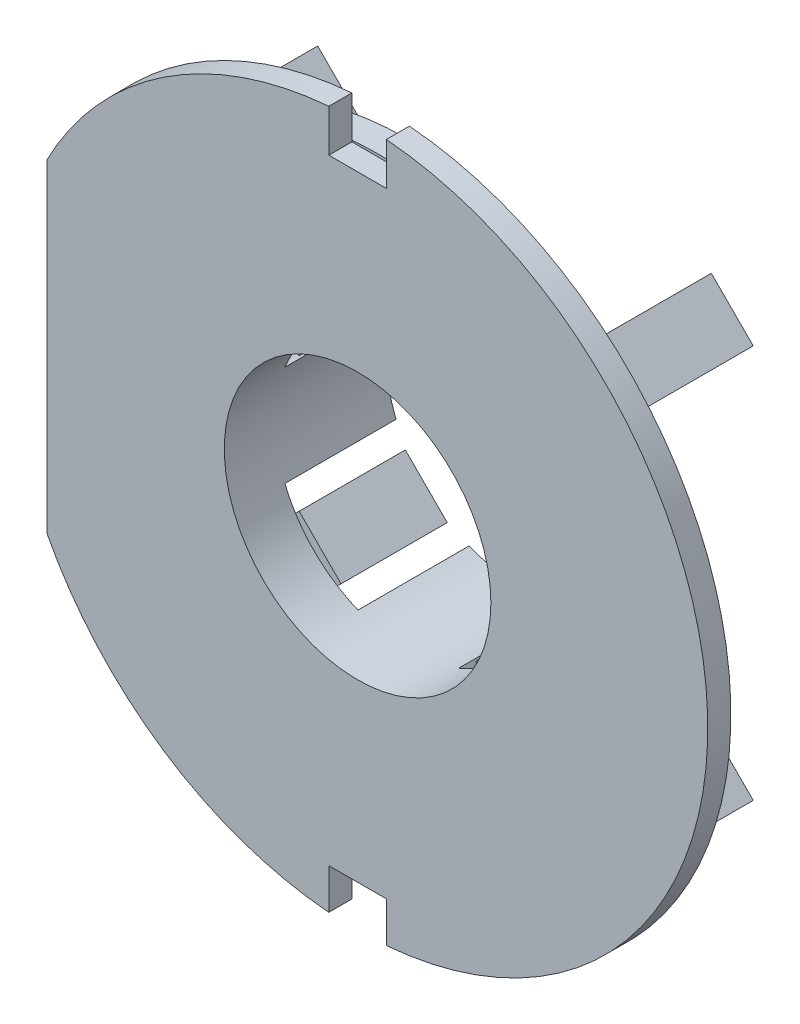
from build123d import *
from build123d.topology import SkipClean

# Parameters (mm, degrees)
SKETCH1_R           = 25.0571
BOSS_EXTRUDE1_DEPTH = 1.651
SKETCH2_W           = 50.1142
SKETCH2_H           = 50.1142
CUT_EXTRUDE1_DEPTH  = 36.474530607
SKETCH3_W           = 4.1148
SKETCH3_H           = 6.235392346
SKETCH3_H_2         = 5.956607654
CUT_EXTRUDE2_DEPTH  = 36.474530607
SKETCH4_R           = 22.1361
BOSS_EXTRUDE2_DEPTH = 1.9812
SKETCH6_R           = 9.5377
CUT_EXTRUDE3_DEPTH  = 36.562290462
BOSS_EXTRUDE3_DEPTH = 7.5946
BOSS_EXTRUDE4_DEPTH = 7.9502
REVOLVE1_ANGLE      = 20
CUT_EXTRUDE4_START  = -7.9502
CUT_EXTRUDE4_DEPTH  = 7.9502
CIRPATTERN1_COUNT   = 4


# Read off the part's stored shape, not the designer's step: Revolve1
with BuildPart() as part:
    # Sketch1 → Boss-Extrude1 (new body)
    with BuildSketch(Plane.XY):
        with Locations(Location((0, 0, 0), (0, 0, 180))):
            Circle(SKETCH1_R)
    extrude(amount=BOSS_EXTRUDE1_DEPTH)

    # Sketch2 → Cut-Extrude1 (cut, through all)
    with BuildSketch(Plane.XY.offset(1.651)):
        with Locations((-47.2948, 0)):
            Rectangle(SKETCH2_W, SKETCH2_H)
    extrude(amount=-CUT_EXTRUDE1_DEPTH, mode=Mode.SUBTRACT)

    # Sketch3 → Cut-Extrude2 (cut, through all)
    with BuildSketch(Plane.XY.offset(1.651)):
        with Locations((0, 25.0571)):
            Rectangle(SKETCH3_W, SKETCH3_H)
        with Locations((0, -25.0571)):
            Rectangle(SKETCH3_W, SKETCH3_H_2)
    extrude(amount=-CUT_EXTRUDE2_DEPTH, mode=Mode.SUBTRACT)

    # Sketch4 → Boss-Extrude2 (add)
    with BuildSketch(Plane(origin=(0, 0, 0), x_dir=(-1, 0, 0), z_dir=(0, 0, -1))):
        with Locations(Location((0, 0, 0), (0, 0, 180))):
            Circle(SKETCH4_R)
    extrude(amount=BOSS_EXTRUDE2_DEPTH)

    # Sketch6 → Cut-Extrude3 (cut, through all)
    with BuildSketch(Plane.XY.offset(1.651)):
        Circle(SKETCH6_R)
    extrude(amount=-CUT_EXTRUDE3_DEPTH, mode=Mode.SUBTRACT)

    # Sketch5 → Boss-Extrude3 (add)
    with BuildSketch(Plane(origin=(0, 0, -1.9812), x_dir=(-1, 0, 0), z_dir=(0, 0, -1))):
        Polygon((17.080278923, -14.080873379), (7.812654606, -4.813249062), (4.813249062, -7.812654606), (14.080873379, -17.080278923), align=None)
    boss_extrude3 = extrude(amount=BOSS_EXTRUDE3_DEPTH)

    # Sketch7 → Boss-Extrude4 (add)
    with SkipClean():  # the faces are left unmerged after this step: merging them gives an invalid solid
        with BuildSketch(Plane(origin=(0, 0, -1.9812), x_dir=(-1, 0, 0), z_dir=(0, 0, -1))):
            with BuildLine():
                Line((8.831119657, 3.602644432), (10.242217338, 4.1783))
                ThreePointArc((10.242217338, 4.1783), (11.0617, 0), (10.242217338, -4.1783))
                Line((10.242217338, -4.1783), (8.831119657, -3.602644432))
                ThreePointArc((8.831119657, -3.602644432), (9.5377, 0), (8.831119657, 3.602644432))
            make_face()
        boss_extrude4 = extrude(amount=BOSS_EXTRUDE4_DEPTH)

    # Revolve1 outline → Revolve1 (revolve)
    with SkipClean():  # the faces are left unmerged after this step: merging them gives an invalid solid
        with BuildSketch(Plane(origin=(0, 0, 0), x_dir=(-0.9848077530122078, 0.17364817766693158, 0), z_dir=(0.17364817766693158, 0.9848077530122078, 0))):
            Polygon((11.0617, -1.9812), (11.0617, -9.9314), (15.48894278, -1.9812), align=None)
        revolve1 = revolve(axis=Axis((0, 0, 0), (0, 0, 1)), revolution_arc=REVOLVE1_ANGLE)

    # Sketch9 → Cut-Extrude4 (cut)
    with SkipClean():  # the faces are left unmerged after this step: merging them gives an invalid solid
        with BuildSketch(Plane(origin=(0, 0, -9.9314), x_dir=(-1, 0, 0), z_dir=(0, 0, -1)).offset(CUT_EXTRUDE4_START)):
            with BuildLine():
                Line((11.030854756, -0.8255), (15.48894278, -0.8255))
                Line((15.48894278, -0.8255), (15.48894278, -2.731118515))
                Line((15.48894278, -2.731118515), (10.893647921, -1.920844047))
                ThreePointArc((10.893647921, -1.920844047), (10.975923608, -1.374884662), (11.030854756, -0.8255))
            make_face()
            with BuildLine():
                Line((11.030854756, 0.8255), (15.48894278, 0.8255))
                Line((15.48894278, 0.8255), (15.48894278, 2.731118515))
                Line((15.48894278, 2.731118515), (10.893647921, 1.920844047))
                ThreePointArc((10.893647921, 1.920844047), (10.975923608, 1.374884662), (11.030854756, 0.8255))
            make_face()
        cut_extrude4 = extrude(amount=CUT_EXTRUDE4_DEPTH, mode=Mode.SUBTRACT)

    # CirPattern1: Boss-Extrude3, Boss-Extrude4, Revolve1, Cut-Extrude4 ×4 about axis
    with SkipClean():  # the faces are left unmerged after this step: merging them gives an invalid solid
        cirpattern1_axis = Axis((0, 0, 0), (0, 0, 1))
        add([boss_extrude3.rotate(cirpattern1_axis, i * 360 / CIRPATTERN1_COUNT) for i in range(1, CIRPATTERN1_COUNT)])
        add([boss_extrude4.rotate(cirpattern1_axis, i * 360 / CIRPATTERN1_COUNT) for i in range(1, CIRPATTERN1_COUNT)])
        add([revolve1.rotate(cirpattern1_axis, i * 360 / CIRPATTERN1_COUNT) for i in range(1, CIRPATTERN1_COUNT)])
        add([cut_extrude4.rotate(cirpattern1_axis, i * 360 / CIRPATTERN1_COUNT) for i in range(1, CIRPATTERN1_COUNT)], mode=Mode.SUBTRACT)


solid = part.part
